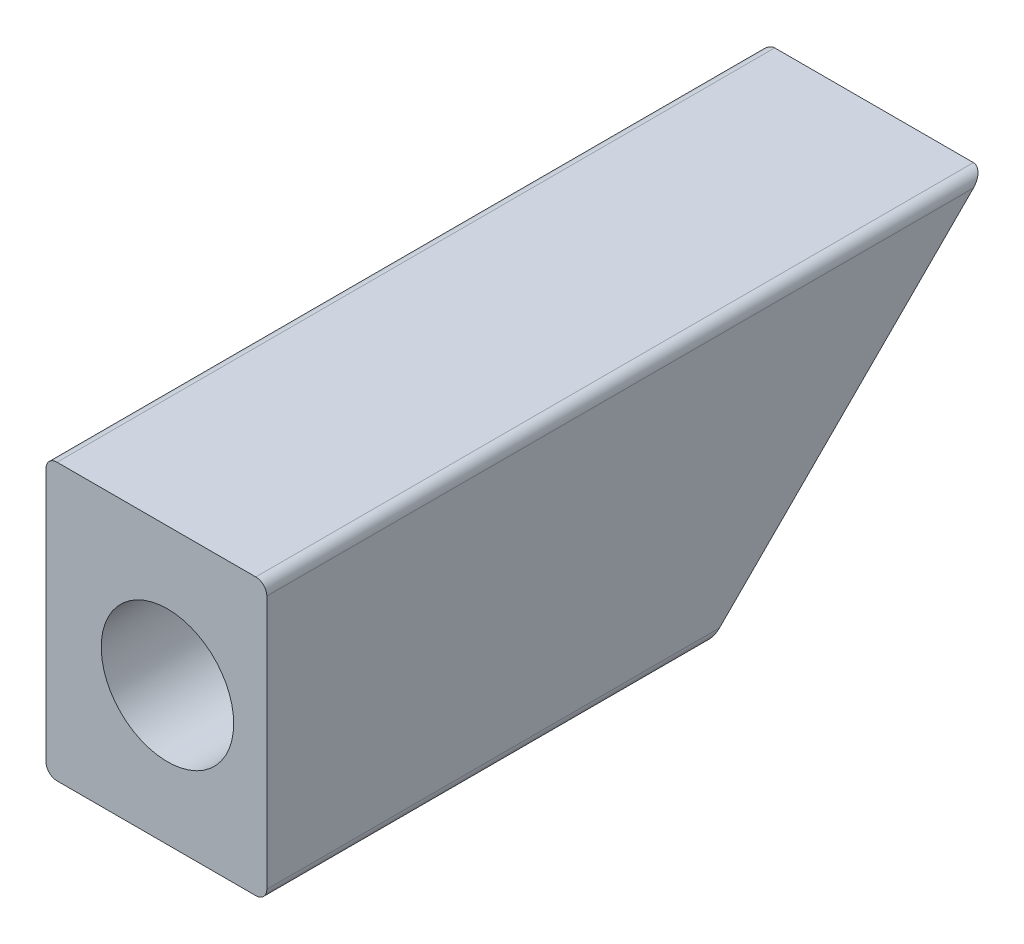
from build123d import *

# Parameters (mm, degrees)
BOSS_EXTRUDE1_DEPTH     = 20
CUT_EXTRUDE1_DEPTH      = 43
CUT_EXTRUDE1_DEPTH_BACK = 67
SKETCH2_R               = 6
FILLET1_R               = 1
SKETCH4_R               = 11
CUT_EXTRUDE2_DEPTH      = 2


with BuildPart() as part:
    # Sketch1 → Boss-Extrude1 (new body)
    with BuildSketch(Plane(origin=(0, 0, 0), x_dir=(0, 0, -1), z_dir=(1, 0, 0))):
        Polygon((45, 12.5), (-20, 12.5), (-20, -12.5), (20, -12.5), align=None)
    extrude(amount=BOSS_EXTRUDE1_DEPTH)

    # Sketch2 → Cut-Extrude1 (cut, two sides: drawn at the far end of the back side and taken through both)
    with BuildSketch(Plane.XY.offset(-CUT_EXTRUDE1_DEPTH_BACK)):
        with Locations((11, 0)):
            Circle(SKETCH2_R)
    extrude(amount=CUT_EXTRUDE1_DEPTH + CUT_EXTRUDE1_DEPTH_BACK, mode=Mode.SUBTRACT)

    # Fillet1
    fillet1_edges = [part.edges().sort_by_distance(p)[0] for p in [
        (0, 12.5, -12.5),
        (0, -12.5, 0),
        (20, -12.5, 0),
        (20, 12.5, -12.5),
    ]]
    fillet(fillet1_edges, radius=FILLET1_R)

    # Sketch4 → Cut-Extrude2 (cut)
    with BuildSketch(Plane.ZY):
        Circle(SKETCH4_R)
    extrude(amount=-CUT_EXTRUDE2_DEPTH, mode=Mode.SUBTRACT)


solid = part.part
